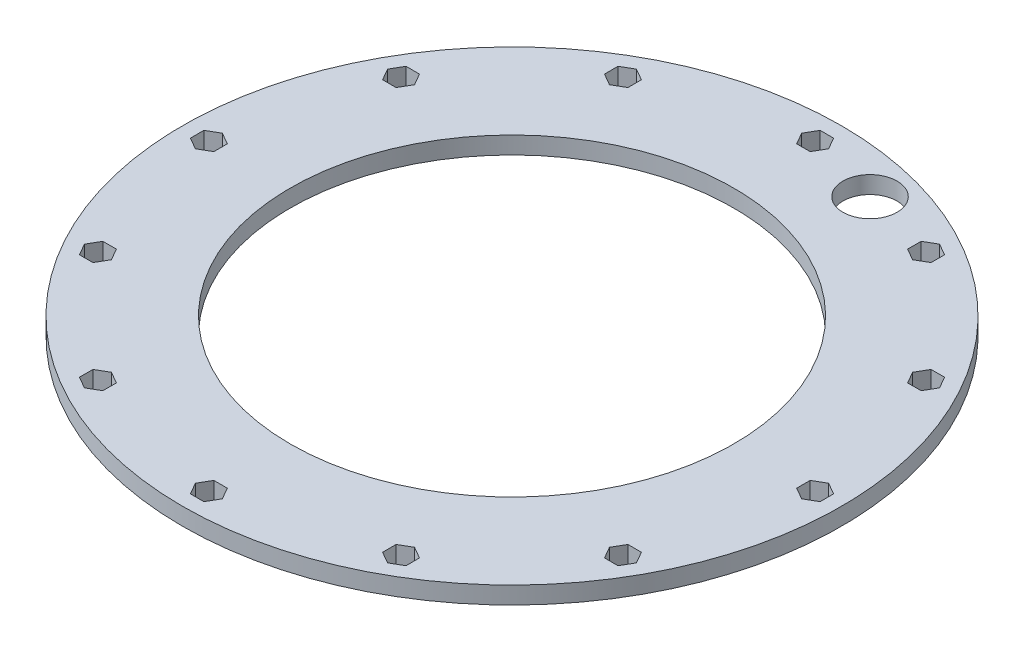
from build123d import *

# Parameters (mm, degrees)
SKETCH1_R           = 76.1
SKETCH1_R_2         = 51.2
BOSS_EXTRUDE1_DEPTH = 4
CUT_EXTRUDE1_DEPTH  = 108.695960927
SKETCH3_R           = 6.25
CUT_EXTRUDE2_DEPTH  = 10


with BuildPart() as part:
    # Sketch1 → Boss-Extrude1 (new body)
    with BuildSketch(Plane(origin=(0, 0, 0), x_dir=(1, 0, 0), z_dir=(0, 1, 0))):
        Circle(SKETCH1_R)
        Circle(SKETCH1_R_2, mode=Mode.SUBTRACT)
    extrude(amount=BOSS_EXTRUDE1_DEPTH)

    # Sketch2 → Cut-Extrude1 (cut, through all)
    with BuildSketch(Plane(origin=(0, 4, 0), x_dir=(1, 0, 0), z_dir=(0, 1, 0))):
        Polygon((37.7, 59.062932538), (37.7, 62.180623992), (35, 63.739469719), (32.3, 62.180623992), (32.3, 59.062932538), (35, 57.504086811), align=None)
        Polygon((3.117691454, 70), (1.558845727, 72.7), (-1.558845727, 72.7), (-3.117691454, 70), (-1.558845727, 67.3), (1.558845727, 67.3), align=None)
        Polygon((62.180623992, 32.3), (63.739469719, 35), (62.180623992, 37.7), (59.062932538, 37.7), (57.504086811, 35), (59.062932538, 32.3), align=None)
        Polygon((70, -3.117691454), (72.7, -1.558845727), (72.7, 1.558845727), (70, 3.117691454), (67.3, 1.558845727), (67.3, -1.558845727), align=None)
        Polygon((59.062932538, -37.7), (62.180623992, -37.7), (63.739469719, -35), (62.180623992, -32.3), (59.062932538, -32.3), (57.504086811, -35), align=None)
        Polygon((32.3, -62.180623992), (35, -63.739469719), (37.7, -62.180623992), (37.7, -59.062932538), (35, -57.504086811), (32.3, -59.062932538), align=None)
        Polygon((-3.117691454, -70), (-1.558845727, -72.7), (1.558845727, -72.7), (3.117691454, -70), (1.558845727, -67.3), (-1.558845727, -67.3), align=None)
        Polygon((-37.7, -59.062932538), (-37.7, -62.180623992), (-35, -63.739469719), (-32.3, -62.180623992), (-32.3, -59.062932538), (-35, -57.504086811), align=None)
        Polygon((-62.180623992, -32.3), (-63.739469719, -35), (-62.180623992, -37.7), (-59.062932538, -37.7), (-57.504086811, -35), (-59.062932538, -32.3), align=None)
        Polygon((-70, 3.117691454), (-72.7, 1.558845727), (-72.7, -1.558845727), (-70, -3.117691454), (-67.3, -1.558845727), (-67.3, 1.558845727), align=None)
        Polygon((-59.062932538, 37.7), (-62.180623992, 37.7), (-63.739469719, 35), (-62.180623992, 32.3), (-59.062932538, 32.3), (-57.504086811, 35), align=None)
        Polygon((-32.3, 62.180623992), (-35, 63.739469719), (-37.7, 62.180623992), (-37.7, 59.062932538), (-35, 57.504086811), (-32.3, 59.062932538), align=None)
    extrude(amount=-CUT_EXTRUDE1_DEPTH, mode=Mode.SUBTRACT)

    # Sketch3 → Cut-Extrude2 (cut)
    with BuildSketch(Plane(origin=(0, 4, 0), x_dir=(1, 0, 0), z_dir=(0, 1, 0))):
        with Locations((17.470285544, 65.199993275)):
            Circle(SKETCH3_R)
    extrude(amount=-CUT_EXTRUDE2_DEPTH, mode=Mode.SUBTRACT)


solid = part.part
